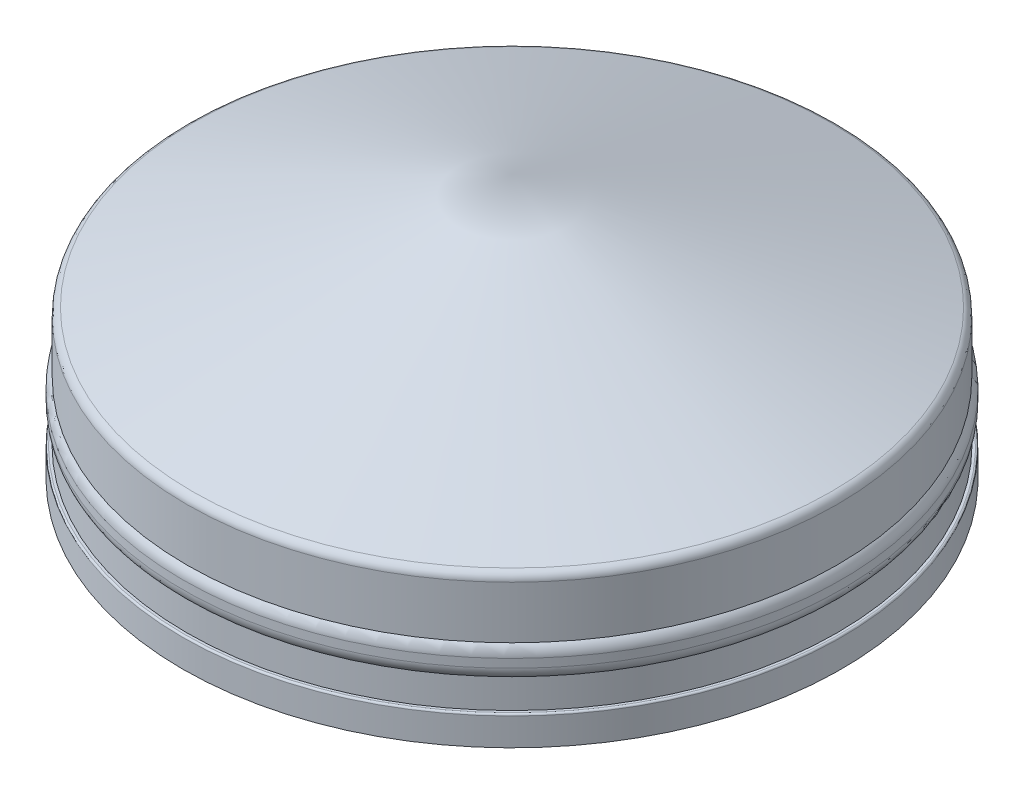
from build123d import *

# Parameters (mm, degrees)
SKETCH1_R           = 11.25
BOSS_EXTRUDE1_DEPTH = 1
SKETCH2_R           = 11.105
BOSS_EXTRUDE2_DEPTH = 1
SKETCH3_R           = 11.25
BOSS_EXTRUDE3_DEPTH = 1
SKETCH4_R           = 11.1
BOSS_EXTRUDE4_DEPTH = 2
FILLET1_R           = 0.3
FILLET3_R           = 0.5
FILLET4_R           = 0.06


with BuildPart() as part:
    # Sketch1 → Boss-Extrude1 (new body)
    with BuildSketch(Plane(origin=(0, 0, 0), x_dir=(1, 0, 0), z_dir=(0, 1, 0))):
        with Locations(Location((0, 0, 0), (0, 0, 270))):
            Circle(SKETCH1_R)
    extrude(amount=BOSS_EXTRUDE1_DEPTH)

    # Sketch2 → Boss-Extrude2 (add)
    with BuildSketch(Plane(origin=(0, 1, 0), x_dir=(1, 0, 0), z_dir=(0, 1, 0))):
        with Locations(Location((0, 0, 0), (0, 0, 270))):
            Circle(SKETCH2_R)
    extrude(amount=BOSS_EXTRUDE2_DEPTH)

    # Sketch3 → Boss-Extrude3 (add)
    with BuildSketch(Plane(origin=(0, 2, 0), x_dir=(1, 0, 0), z_dir=(0, 1, 0))):
        with Locations(Location((0, 0, 0), (0, 0, 270))):
            Circle(SKETCH3_R)
    extrude(amount=BOSS_EXTRUDE3_DEPTH)

    # Sketch4 → Boss-Extrude4 (add)
    with BuildSketch(Plane(origin=(0, 3, 0), x_dir=(1, 0, 0), z_dir=(0, 1, 0))):
        with Locations(Location((0, 0, 0), (0, 0, 270))):
            Circle(SKETCH4_R)
    extrude(amount=BOSS_EXTRUDE4_DEPTH)

    # Sketch6 → Revolve1 (revolve)
    with BuildSketch(Plane(origin=(0, 0, 0), x_dir=(0.06000839273320703, 0, 0.9981978725691502), z_dir=(-0.9981978725691503, 0, 0.06000839273320704)), mode=Mode.PRIVATE) as revolve1_sk:
        Polygon((11.1, 5), (0, 5), (0, 9), align=None)
    revolve(revolve1_sk.sketch.rotate(Axis((0, 5, 0), (0, 1, 0)), 176.559705496), axis=Axis((0, 5, 0), (0, 1, 0)))

    # Fillet1
    fillet1_edges = [part.edges().sort_by_distance(p)[0] for p in [
        (-11.1, 5, 0),
    ]]
    fillet(fillet1_edges, radius=FILLET1_R)

    # Fillet3
    # the kernel refuses this fillet: 0.5 mm, written as the material it takes off along each edge
    with BuildSketch(Plane(origin=(0, 3, 0), x_dir=(0, 0, 1), z_dir=(-1, 0, 0))) as fillet3_piece_1:
        with BuildLine():
            CenterArc((10.75, -0.357071421), FILLET3_R, 0, 45.572995999)
            Line((11.25, -0.357071421), (11.26, -0.357071421))
            Line((11.26, -0.357071421), (11.26, 0))
            Line((11.26, 0), (11.25, 0.01))
            ThreePointArc((11.25, 0.01), (11.175, 0.01), (11.107, 0.007141428))
            Line((11.107, 0.007141428), (11.1, 0))
        make_face()
    revolve(axis=Axis((0, 3, 0), (0, 1, 0)), mode=Mode.SUBTRACT)
    with BuildSketch(Plane(origin=(0, 2, 0), x_dir=(0, 0, 1), z_dir=(-1, 0, 0))) as fillet3_piece_2:
        with BuildLine():
            CenterArc((10.75, 0.352100838), FILLET3_R, 315.234915329, 44.765084671)
            Line((11.105, 0), (11.1121, -0.007042017))
            ThreePointArc((11.1121, -0.007042017), (11.1775, -0.01), (11.25, -0.01))
            Line((11.25, -0.01), (11.26, 0))
            Line((11.26, 0), (11.26, 0.352100838))
            Line((11.26, 0.352100838), (11.25, 0.352100838))
        make_face()
    revolve(axis=Axis((0, 2, 0), (0, 1, 0)), mode=Mode.SUBTRACT)

    # Fillet4
    fillet4_edges = [part.edges().sort_by_distance(p)[0] for p in [
        (0, 1, -11.25),
    ]]
    fillet(fillet4_edges, radius=FILLET4_R)


solid = part.part
